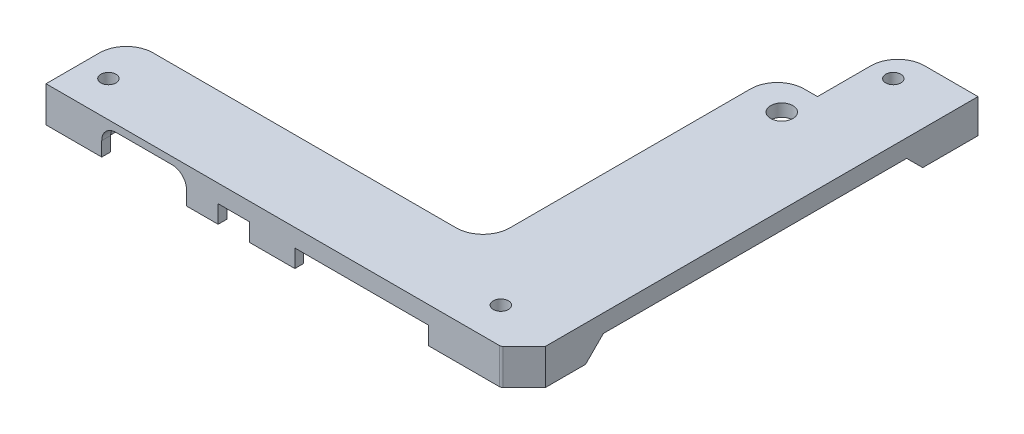
from build123d import *

# Parameters (mm, degrees)
EXTRUDE_1_DEPTH     = 2
SKETCH_3_W          = 9.5
SKETCH_3_H          = 8
CUT_EXTRUDE_1_DEPTH = 1.2
SKETCH_4_W          = 5
SKETCH_4_H          = 5
CUT_EXTRUDE_2_DEPTH = 1
EXTRUDE_2_DEPTH     = 1
FILLET_1_R          = 1.6
SKETCH_6_W          = 9.5
SKETCH_6_H          = 6
SKETCH_6_W_2        = 9
SKETCH_6_W_3        = 4.6
SKETCH_6_H_2        = 8
EXTRUDE_3_DEPTH     = 2
CHAMFER_1_SIZE      = 2.5
CHAMFER_2_SIZE      = 2
FILLET_2_R          = 3
SKETCH_7_R          = 0.85
CUT_EXTRUDE_3_DEPTH = 74.33655296
SKETCH_8_R          = 1.25
CUT_EXTRUDE_4_DEPTH = 74.33655296
SKETCH_9_R          = 2.5
CUT_EXTRUDE_5_DEPTH = 0.6
FILLET_3_R          = 0.4
SKETCH_10_W         = 12.125863774
SKETCH_10_H         = 8.335254798
CUT_EXTRUDE_6_DEPTH = 0.2
EXTRUDE_4_DEPTH     = 1


with BuildPart() as part:
    # 草图2 → 凸台-拉伸1 (new body)
    with BuildSketch(Plane(origin=(0, 0, 0), x_dir=(1, 0, 0), z_dir=(0, 1, 0))):
        Polygon((40, 41), (44.5, 41), (44.5, 50), (53.5, 50), (53.5, 0), (0, 0), (0, 8), (40, 8), align=None)
    extrude(amount=EXTRUDE_1_DEPTH)

    # 草图3 → 切除-拉伸1 (cut)
    with BuildSketch(Plane.XZ):
        with Locations((11, -4)):
            Rectangle(SKETCH_3_W, SKETCH_3_H)
    extrude(amount=-CUT_EXTRUDE_1_DEPTH, mode=Mode.SUBTRACT)

    # 草图4 → 切除-拉伸2 (cut)
    with BuildSketch(Plane.XZ):
        with Locations((20.9, -2.5)):
            Rectangle(SKETCH_4_W, SKETCH_4_H)
    extrude(amount=-CUT_EXTRUDE_2_DEPTH, mode=Mode.SUBTRACT)

    # 草图5 → 凸台-拉伸2 (add)
    with BuildSketch(Plane.XY):
        Polygon((0, 0), (0, -2), (6.25, -2), (6.25, 0), (6.25, 1.2), (15.75, 1.2), (15.75, -2), (18.4, -2), (18.4, 1), (23.4, 1), (23.4, 0), (23.4, -2), (27.9, -2), (27.9, 0), (42.9, 0), (42.9, -2), (53.5, -2), (53.5, 0), (53.5, 2), (0, 2), align=None)
    extrude(amount=EXTRUDE_2_DEPTH)

    # 圆角1
    fillet_1_edges = [part.edges().sort_by_distance(p)[0] for p in [
        (15.75, 1.2, -3.5),
        (6.25, 1.2, -3.5),
    ]]
    fillet(fillet_1_edges, radius=FILLET_1_R)

    # 草图6 → 凸台-拉伸3 (add)
    with BuildSketch(Plane.XZ):
        with Locations((48.75, -3)):
            Rectangle(SKETCH_6_W, SKETCH_6_H)
        with Locations((49, -47)):
            Rectangle(SKETCH_6_W_2, SKETCH_6_H)
        with Locations((2.3, -4)):
            Rectangle(SKETCH_6_W_3, SKETCH_6_H_2)
    extrude(amount=EXTRUDE_3_DEPTH)

    # 倒角1
    chamfer_1_edges = [part.edges().sort_by_distance(p)[0] for p in [
        (53.5, 0, 1),
    ]]
    chamfer(chamfer_1_edges, length=CHAMFER_1_SIZE)

    # 倒角2
    chamfer_2_edges = [part.edges().sort_by_distance(p)[0] for p in [
        (48.75, 0, -6),
        (49, 0, -44),
    ]]
    chamfer(chamfer_2_edges, length=CHAMFER_2_SIZE - 0.0001)  # a hair under: the kernel refuses the full size

    # 圆角2
    fillet_2_edges = [part.edges().sort_by_distance(p)[0] for p in [
        (0, 0, -8),
        (40, 1, -8),
        (40, 1, -41),
        (44.5, 0, -50),
    ]]
    fillet(fillet_2_edges, radius=FILLET_2_R)

    # 草图7 → 切除-拉伸3 (cut, through all)
    with BuildSketch(Plane.XZ.offset(2)):
        with Locations(Location((47, -3, 0), (0, 0, 270))):
            Circle(SKETCH_7_R)
        with Locations(Location((47, -47, 0), (0, 0, 270))):
            Circle(SKETCH_7_R)
        with Locations(Location((3, -3, 0), (0, 0, 270))):
            Circle(SKETCH_7_R)
    extrude(amount=-CUT_EXTRUDE_3_DEPTH, mode=Mode.SUBTRACT)

    # 草图8 → 切除-拉伸4 (cut, through all)
    with BuildSketch(Plane(origin=(0, 2, 0), x_dir=(1, 0, 0), z_dir=(0, 1, 0))):
        with Locations(Location((44, 37.5, 0), (0, 0, 270))):
            Circle(SKETCH_8_R)
    extrude(amount=-CUT_EXTRUDE_4_DEPTH, mode=Mode.SUBTRACT)

    # 草图9 → 切除-拉伸5 (cut)
    with BuildSketch(Plane.XZ):
        with Locations(Location((44, -37.5, 0), (0, 0, 270))):
            Circle(SKETCH_9_R)
    extrude(amount=-CUT_EXTRUDE_5_DEPTH, mode=Mode.SUBTRACT)

    # 圆角3
    fillet_3_edges = [part.edges().sort_by_distance(p)[0] for p in [
        (51, 0, 1),
    ]]
    fillet(fillet_3_edges, radius=FILLET_3_R)

    # 草图10 → 切除-拉伸6 (cut)
    with BuildSketch(Plane.XZ.offset(2)):
        with Locations((49.021088356, -47.204499244)):
            Rectangle(SKETCH_10_W, SKETCH_10_H)
    extrude(amount=-CUT_EXTRUDE_6_DEPTH, mode=Mode.SUBTRACT)

    # 草图11 → 凸台-拉伸4 (add)
    with BuildSketch(Plane.XY.offset(1)):
        Polygon((23.4, 1), (23.4, -2), (22.8, -2), (22.8, 0), (19.3, 0), (19.3, -2), (18.4, -2), (18.4, 1), align=None)
    extrude(amount=-EXTRUDE_4_DEPTH)


solid = part.part
